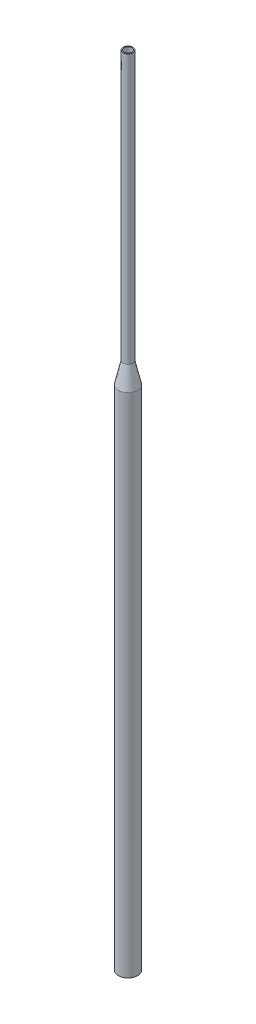
from build123d import *

# Parameters (mm, degrees)
ESQUISSE1_R             = 5
BOSS_EXTRU_1_DEPTH      = 820
ESQUISSE2_R             = 10
BOSS_EXTRU_2_DEPTH      = 500
CHANFREIN1_SIZE         = 10
CHANFREIN1_SIZE_2       = 43.314758743
ESQUISSE3_R             = 4
ENL_V_MAT_EXTRU_1_DEPTH = 821.121942153


with BuildPart() as part:
    # Esquisse1 → Boss.-Extru.1 (new body)
    with BuildSketch(Plane(origin=(0, 0, 0), x_dir=(1, 0, 0), z_dir=(0, 1, 0))):
        with Locations(Location((0, 0, 0), (0, 0, 270))):
            Circle(ESQUISSE1_R)
    extrude(amount=BOSS_EXTRU_1_DEPTH)

    # Esquisse2 → Boss.-Extru.2 (add)
    with BuildSketch(Plane(origin=(0, 0, 0), x_dir=(1, 0, 0), z_dir=(0, 1, 0))):
        with Locations(Location((0, 0, 0), (0, 0, 270))):
            Circle(ESQUISSE2_R)
    extrude(amount=BOSS_EXTRU_2_DEPTH)

    # Chanfrein1
    # the kernel refuses this chamfer: 43.314758743, 10 mm, written as the material it adds along each edge
    with BuildSketch(Plane(origin=(0, 500, 0), x_dir=(0, 0, 1), z_dir=(1, 0, 0))) as chanfrein1_piece_1_section:
        Polygon((5 + CHANFREIN1_SIZE, 0), (5, -CHANFREIN1_SIZE_2), (5, 0), align=None)
    chanfrein1_piece_1 = revolve(axis=Axis((0, 500, 0), (0, -1, 0)), mode=Mode.PRIVATE)
    chanfrein1_piece_1 = chanfrein1_piece_1 & Plane(origin=(0, 533.283833366, 0), x_dir=(0, 0, 1), z_dir=(0, -1, 0)) * Cylinder(10, 174, mode=Mode.PRIVATE)
    add(chanfrein1_piece_1)

    # Esquisse3 → Enlèv. mat.-Extru.1 (cut, through all)
    with BuildSketch(Plane(origin=(0, 820, 0), x_dir=(1, 0, 0), z_dir=(0, 1, 0))):
        with Locations(Location((0, 0, 0), (0, 0, 270))):
            Circle(ESQUISSE3_R)
    extrude(amount=-ENL_V_MAT_EXTRU_1_DEPTH, mode=Mode.SUBTRACT)


solid = part.part
